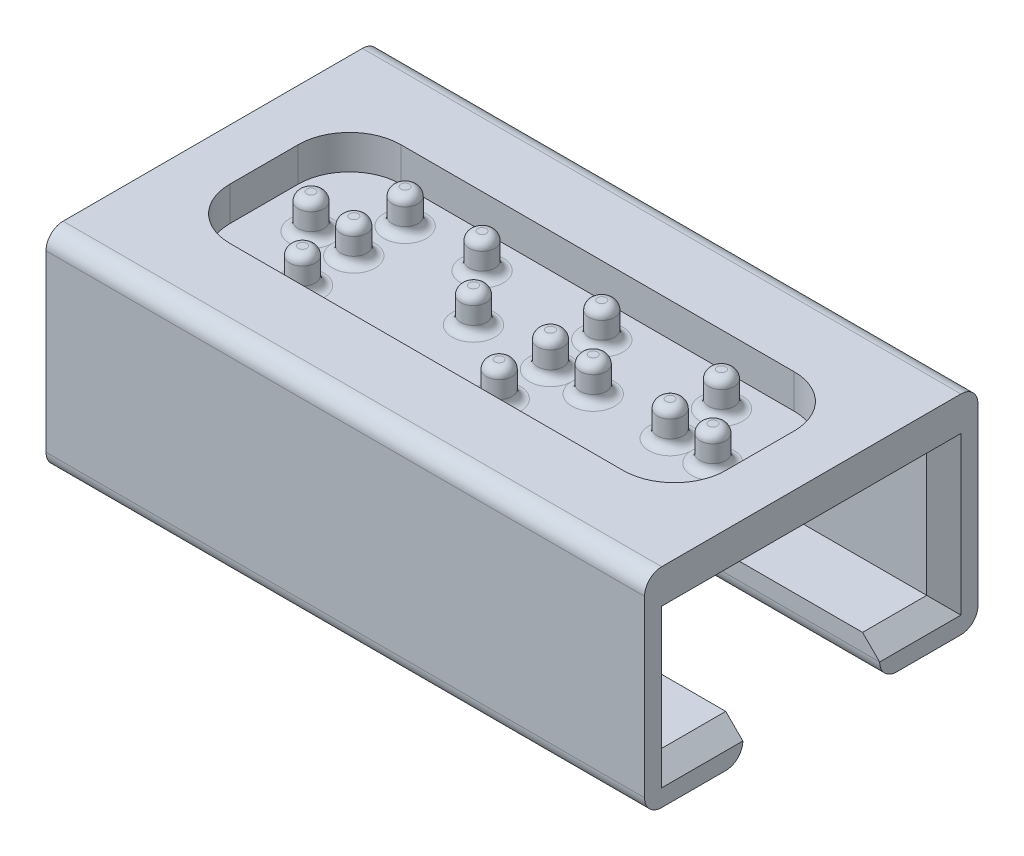
from build123d import *

# Parameters (mm, degrees)
SKETCH1_R              = 0.75
BOSS_EXTRUDE1_DEPTH    = 2
BOSS_EXTRUDE1_2_DEPTH  = 2
BOSS_EXTRUDE1_3_DEPTH  = 2
BOSS_EXTRUDE1_4_DEPTH  = 2
BOSS_EXTRUDE1_5_DEPTH  = 2
BOSS_EXTRUDE1_6_DEPTH  = 2
BOSS_EXTRUDE1_7_DEPTH  = 2
BOSS_EXTRUDE1_8_DEPTH  = 2
BOSS_EXTRUDE1_9_DEPTH  = 2
BOSS_EXTRUDE1_10_DEPTH = 2
BOSS_EXTRUDE1_11_DEPTH = 2
BOSS_EXTRUDE1_12_DEPTH = 2
BOSS_EXTRUDE1_13_DEPTH = 2
SKETCH1_3_W            = 35
SKETCH1_3_H            = 19.5
BOSS_EXTRUDE2_DEPTH    = 1
FILLET1_R              = 0.5
SKETCH1_4_W            = 35
SKETCH1_4_H            = 17.5
SKETCH1_4_H_2          = 2
BOSS_EXTRUDE3_DEPTH    = 2
SKETCH1_5_W            = 35
SKETCH1_5_H            = 2
BOSS_EXTRUDE4_DEPTH    = 8.2
BOSS_EXTRUDE5_REACH    = 35.499
SKETCH2_3_W            = 35
SKETCH2_3_H            = 2
SKETCH2_3_H_2          = 7.75
BOSS_EXTRUDE6_DEPTH    = 2
FILLET2_R              = 1
CHAMFER1_SIZE          = 1
CUT_EXTRUDE1_DEPTH     = 2
FILLET3_R              = 1
CHAMFER2_SIZE          = 1


with BuildPart() as part:
    # Sketch1 → Boss-Extrude1 (new body)
    with BuildSketch(Plane(origin=(0, 0, 0), x_dir=(1, 0, 0), z_dir=(0, 1, 0))):
        with Locations(Location((2.5, 3, 0), (0, 0, 270))):
            Circle(SKETCH1_R)
    extrude(amount=BOSS_EXTRUDE1_DEPTH)



with BuildPart() as body_2:
    # Sketch1 → Boss-Extrude1 2 (new body)
    with BuildSketch(Plane(origin=(0, 0, 0), x_dir=(1, 0, 0), z_dir=(0, 1, 0))):
        with Locations(Location((2.5, 6, 0), (0, 0, 270))):
            Circle(SKETCH1_R)
    extrude(amount=BOSS_EXTRUDE1_2_DEPTH)


with BuildPart() as body_3:
    # Sketch1 → Boss-Extrude1 3 (new body)
    with BuildSketch(Plane(origin=(0, 0, 0), x_dir=(1, 0, 0), z_dir=(0, 1, 0))):
        with Locations(Location((2.5, 0, 0), (0, 0, 270))):
            Circle(SKETCH1_R)
    extrude(amount=BOSS_EXTRUDE1_3_DEPTH)


with BuildPart() as body_4:
    # Sketch1 → Boss-Extrude1 4 (new body)
    with BuildSketch(Plane(origin=(0, 0, 0), x_dir=(1, 0, 0), z_dir=(0, 1, 0))):
        with Locations(Location((0, 3, 0), (0, 0, 270))):
            Circle(SKETCH1_R)
    extrude(amount=BOSS_EXTRUDE1_4_DEPTH)


with BuildPart() as body_5:
    # Sketch1 → Boss-Extrude1 5 (new body)
    with BuildSketch(Plane(origin=(0, 0, 0), x_dir=(1, 0, 0), z_dir=(0, 1, 0))):
        with Locations(Location((7, 6, 0), (0, 0, 270))):
            Circle(SKETCH1_R)
    extrude(amount=BOSS_EXTRUDE1_5_DEPTH)


with BuildPart() as body_6:
    # Sketch1 → Boss-Extrude1 6 (new body)
    with BuildSketch(Plane(origin=(0, 0, 0), x_dir=(1, 0, 0), z_dir=(0, 1, 0))):
        with Locations(Location((9.5, 3, 0), (0, 0, 270))):
            Circle(SKETCH1_R)
    extrude(amount=BOSS_EXTRUDE1_6_DEPTH)


with BuildPart() as body_7:
    # Sketch1 → Boss-Extrude1 7 (new body)
    with BuildSketch(Plane(origin=(0, 0, 0), x_dir=(1, 0, 0), z_dir=(0, 1, 0))):
        with Locations(Location((14, 6, 0), (0, 0, 270))):
            Circle(SKETCH1_R)
    extrude(amount=BOSS_EXTRUDE1_7_DEPTH)


with BuildPart() as body_8:
    # Sketch1 → Boss-Extrude1 8 (new body)
    with BuildSketch(Plane(origin=(0, 0, 0), x_dir=(1, 0, 0), z_dir=(0, 1, 0))):
        with Locations(Location((14, 3, 0), (0, 0, 270))):
            Circle(SKETCH1_R)
    extrude(amount=BOSS_EXTRUDE1_8_DEPTH)


with BuildPart() as body_9:
    # Sketch1 → Boss-Extrude1 9 (new body)
    with BuildSketch(Plane(origin=(0, 0, 0), x_dir=(1, 0, 0), z_dir=(0, 1, 0))):
        with Locations(Location((16.5, 3, 0), (0, 0, 270))):
            Circle(SKETCH1_R)
    extrude(amount=BOSS_EXTRUDE1_9_DEPTH)


with BuildPart() as body_10:
    # Sketch1 → Boss-Extrude1 10 (new body)
    with BuildSketch(Plane(origin=(0, 0, 0), x_dir=(1, 0, 0), z_dir=(0, 1, 0))):
        with Locations(Location((14, 0, 0), (0, 0, 270))):
            Circle(SKETCH1_R)
    extrude(amount=BOSS_EXTRUDE1_10_DEPTH)


with BuildPart() as body_11:
    # Sketch1 → Boss-Extrude1 11 (new body)
    with BuildSketch(Plane(origin=(0, 0, 0), x_dir=(1, 0, 0), z_dir=(0, 1, 0))):
        with Locations(Location((21, 6, 0), (0, 0, 270))):
            Circle(SKETCH1_R)
    extrude(amount=BOSS_EXTRUDE1_11_DEPTH)


with BuildPart() as body_12:
    # Sketch1 → Boss-Extrude1 12 (new body)
    with BuildSketch(Plane(origin=(0, 0, 0), x_dir=(1, 0, 0), z_dir=(0, 1, 0))):
        with Locations(Location((21, 3, 0), (0, 0, 270))):
            Circle(SKETCH1_R)
    extrude(amount=BOSS_EXTRUDE1_12_DEPTH)


with BuildPart() as body_13:
    # Sketch1 → Boss-Extrude1 13 (new body)
    with BuildSketch(Plane(origin=(0, 0, 0), x_dir=(1, 0, 0), z_dir=(0, 1, 0))):
        with Locations(Location((23.5, 3, 0), (0, 0, 270))):
            Circle(SKETCH1_R)
    extrude(amount=BOSS_EXTRUDE1_13_DEPTH)


with BuildPart() as part_1:
    add(part.part)

    add(body_2.part)  # Boss-Extrude2 merges body 2

    add(body_3.part)  # Boss-Extrude2 merges body 3

    add(body_4.part)  # Boss-Extrude2 merges body 4

    add(body_5.part)  # Boss-Extrude2 merges body 5

    add(body_6.part)  # Boss-Extrude2 merges body 6

    add(body_7.part)  # Boss-Extrude2 merges body 7

    add(body_8.part)  # Boss-Extrude2 merges body 8

    add(body_9.part)  # Boss-Extrude2 merges body 9

    add(body_10.part)  # Boss-Extrude2 merges body 10

    add(body_11.part)  # Boss-Extrude2 merges body 11

    add(body_12.part)  # Boss-Extrude2 merges body 12

    add(body_13.part)  # Boss-Extrude2 merges body 13
    # Sketch1<3> → Boss-Extrude2 (add)
    with BuildSketch(Plane(origin=(0, 0, 0), x_dir=(1, 0, 0), z_dir=(0, 1, 0))):
        with Locations((11.75, 3)):
            Rectangle(SKETCH1_3_W, SKETCH1_3_H)
    extrude(amount=-BOSS_EXTRUDE2_DEPTH)

    # Fillet1
    fillet1_edges = [part_1.edges().sort_by_distance(p)[0] for p in [
        (2.5, 0, -6.75),
        (2.5, 2, -6.75),
        (2.5, 0, -3.75),
        (2.5, 2, -3.75),
        (2.5, 0, -0.75),
        (2.5, 2, -0.75),
        (7, 0, -6.75),
        (7, 2, -6.75),
        (9.5, 0, -3.75),
        (9.5, 2, -3.75),
        (14, 0, -6.75),
        (14, 2, -6.75),
        (14, 0, -3.75),
        (14, 2, -3.75),
        (14, 0, -0.75),
        (14, 2, -0.75),
        (16.5, 0, -3.75),
        (16.5, 2, -3.75),
        (0, 2, -3.75),
        (21, 0, -6.75),
        (21, 2, -6.75),
        (21, 0, -3.75),
        (21, 2, -3.75),
        (23.5, 0, -3.75),
        (23.5, 2, -3.75),
        (0, 0, -3.75),
    ]]
    fillet(fillet1_edges, radius=FILLET1_R - 0.0001)  # a hair under: the kernel refuses the full size

    # Sketch1<4> → Boss-Extrude3 (add)
    # profile 1 of 2: a face of its own
    with BuildSketch(Plane(origin=(0, 0, 0), x_dir=(1, 0, 0), z_dir=(0, 1, 0))):
        with Locations((11.75, 2)):
            Rectangle(SKETCH1_4_W, SKETCH1_4_H)
        with BuildLine():
            Line((23.25, -2), (0.25, -2))
            ThreePointArc((0.25, -2), (-1.871320344, -1.121320344), (-2.75, 1))
            Line((-2.75, 1), (-2.75, 5))
            ThreePointArc((-2.75, 5), (-1.871320344, 7.121320344), (0.25, 8))
            Line((0.25, 8), (23.25, 8))
            ThreePointArc((23.25, 8), (25.371320344, 7.121320344), (26.25, 5))
            Line((26.25, 5), (26.25, 1))
            ThreePointArc((26.25, 1), (25.371320344, -1.121320344), (23.25, -2))
        make_face(mode=Mode.SUBTRACT)
    # profile 2 of 2: a face of its own
    with BuildSketch(Plane(origin=(0, 0, 0), x_dir=(1, 0, 0), z_dir=(0, 1, 0))):
        with Locations((11.75, 11.75)):
            Rectangle(SKETCH1_4_W, SKETCH1_4_H_2)
    extrude(amount=BOSS_EXTRUDE3_DEPTH)

    # Sketch1<5> → Boss-Extrude4 (add)
    with BuildSketch(Plane(origin=(0, 0, 0), x_dir=(1, 0, 0), z_dir=(0, 1, 0))):
        with Locations((11.75, 11.75)):
            Rectangle(SKETCH1_5_W, SKETCH1_5_H)
    boss_extrude4 = extrude(amount=-BOSS_EXTRUDE4_DEPTH)

    # Mirror1: Boss-Extrude4 across plane
    add(boss_extrude4.mirror(Plane(origin=(0, 0, -3), x_dir=(1, 0, 0), z_dir=(0, 0, -1))))

    # Sketch2 → Boss-Extrude5 (add, up to next)
    with BuildSketch(Plane.XZ.offset(8.2), mode=Mode.PRIVATE) as boss_extrude5_sk1:
        Polygon((1.384990523, 1), (10.5, 1), (14.25, 4.75), (-5.75, 4.75), align=None)
    boss_extrude5_tool1 = extrude(boss_extrude5_sk1.sketch, amount=-BOSS_EXTRUDE5_REACH, mode=Mode.PRIVATE) - part_1.part
    boss_extrude5 = boss_extrude5_tool1.solids().sort_by_distance((4.990788, -8.2, 3.108664))[0]
    add(boss_extrude5)

    # Mirror2: Boss-Extrude5 across plane
    add(boss_extrude5.mirror(Plane(origin=(0, 0, -3), x_dir=(1, 0, 0), z_dir=(0, 0, -1))))

    # Sketch2<3> → Boss-Extrude6 (add)
    with BuildSketch(Plane.XZ.offset(8.2)):
        with Locations((11.75, -11.75)):
            Rectangle(SKETCH2_3_W, SKETCH2_3_H)
        with Locations((11.75, -6.875)):
            Rectangle(SKETCH2_3_W, SKETCH2_3_H_2)
        Polygon((-5.75, -3), (29.25, -3), (29.25, 1), (10.5, 1), (1.384990523, 1), (-5.75, 1), align=None)
        Polygon((1.384990523, 1), (10.5, 1), (14.25, 4.75), (-5.75, 4.75), align=None)
        Polygon((10.5, 1), (29.25, 1), (29.25, 6.75), (-5.75, 6.75), (-5.75, 4.75), (14.25, 4.75), align=None)
        Polygon((-5.75, 4.75), (-5.75, 1), (1.384990523, 1), align=None)
    extrude(amount=BOSS_EXTRUDE6_DEPTH)

    # Fillet2
    fillet2_edges = [part_1.edges().sort_by_distance(p)[0] for p in [
        (11.75, 2, -12.75),
        (11.75, 2, 6.75),
        (11.75, -10.2, 6.75),
        (11.75, -10.2, -12.75),
    ]]
    fillet(fillet2_edges, radius=FILLET2_R)

    # Chamfer1
    chamfer1_edges = [part_1.edges().sort_by_distance(p)[0] for p in [
        (-5.75, -1, -3),
        (-5.75, -8.2, -3),
    ]]
    chamfer(chamfer1_edges, length=CHAMFER1_SIZE)

    # Sketch2<4> → Cut-Extrude1 (cut)
    with BuildSketch(Plane.XZ.offset(8.2)):
        Polygon((-5.75, -3), (29.25, -3), (29.25, 1), (10.5, 1), (1.384990523, 1), (-5.75, 1), align=None)
    cut_extrude1 = extrude(amount=CUT_EXTRUDE1_DEPTH, mode=Mode.SUBTRACT)

    # Mirror3: Cut-Extrude1 across plane
    add(cut_extrude1.mirror(Plane(origin=(0, 0, -3), x_dir=(1, 0, 0), z_dir=(0, 0, -1))), mode=Mode.SUBTRACT)

    # Fillet3
    fillet3_edges = [part_1.edges().sort_by_distance(p)[0] for p in [
        (11.75, -10.2, -7),
        (11.75, -10.2, 1),
    ]]
    fillet(fillet3_edges, radius=FILLET3_R)

    # Chamfer2
    chamfer2_edges = [part_1.edges().sort_by_distance(p)[0] for p in [
        (29.25, -8.2, 2.875),
        (29.25, -4.6, 4.75),
        (29.25, -8.2, -8.875),
        (29.25, -4.6, -10.75),
        (29.25, -1, -3),
    ]]
    chamfer(chamfer2_edges, length=CHAMFER2_SIZE)


solid = part_1.part
